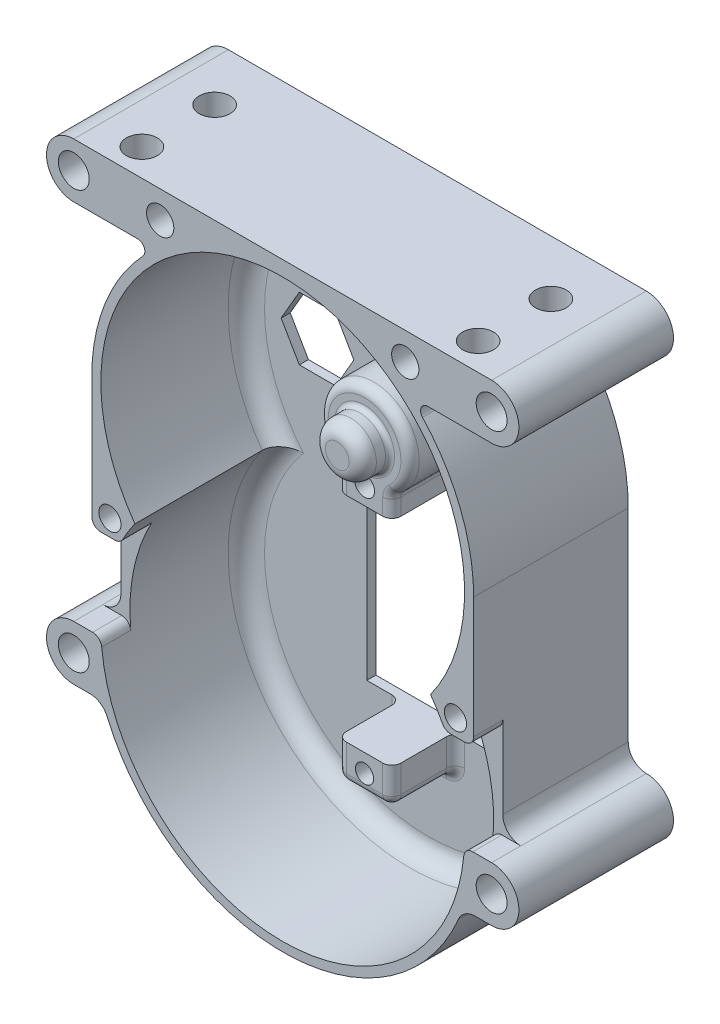
from build123d import *

# Parameters (mm, degrees)
BODY_DEPTH                      = 17
MAIN_BOX_R                      = 20
BOX_DEPTH                       = 16
RACK_CH_DEPTH                   = 3.2
VERRUNDUNG1_R                   = 1
WINGS_START                     = -17
WINGS_DEPTH                     = 17
SKIZZE6_R                       = 1.6999999999999995
WING_HOLE_DEPTH                 = 51.072431865933915
VERRUNDUNG2_R                   = 2
VERRUNDUNG3_R                   = 2
SERVO_HOLE_DEPTH                = 50.74181774893831
SKIZZE8_W                       = 6
SKIZZE8_H                       = 4
SKIZZE8_W_2                     = 5.999999999999996
SERVO_BORE_DEPTH                = 7
SKIZZE10_R                      = 5.000000000000001
GEAR_HOLDER_DEPTH               = 7
MAIN_GEAR_AXIS_R                = 2.8
AXIS_DEPTH                      = 3
VERRUNDUNG11_R                  = 1.5
VERRUNDUNG12_R                  = 0.5
VERRUNDUNG13_R                  = 1
SCREW_HOLE_R                    = 1.0000000000000009
SCREW_HOLE_R_2                  = 1.1000000000000003
SERVO_HOLDER_HOLE_DEPTH         = 48.950478964955025
VERRUNDUNG14_R                  = 1
VERRUNDUNG17_R                  = 1
VERRUNDUNG18_R                  = 2
VERRUNDUNG19_R                  = 1
VERRUNDUNG20_R                  = 1
SCHNITT_LINEAR_AUSTRAGEN1_DEPTH = 50.74181774893831
KREISMUSTER1_COUNT              = 4
KREISMUSTER1_ANGLE              = 180.0000000000004
SKIZZE13_R                      = 1.2193098216311076
SCHNITT_LINEAR_AUSTRAGEN2_DEPTH = 51.072431865933915
BASE_START                      = -17
BASE_WINGS_R                    = 1.6999999999999995
BASE_DEPTH                      = 17
SKIZZE15_R                      = 1.6999999999999995
BASE_HOLES_DEPTH                = 68.90225786791508
VERRUNDUNG22_R                  = 0.8
SKIZZE16_R                      = 1.5000000000000009
SCHNITT_LINEAR_AUSTRAGEN4_DEPTH = 51.072431865933915


with BuildPart() as part:
    # groundplate → body (new body)
    with BuildSketch(Plane.XY):
        with BuildLine():
            Line((22, 5.692561475698), (22.000000000000004, -17.607438524302047))
            ThreePointArc((22.000000000000004, -17.607438524302047), (0.9999999999999785, -38.607438524302005), (-20, -17.607438524302008))
            Line((-20, -17.607438524302008), (-20.000000000000004, 5.692561475697993))
            ThreePointArc((-20.000000000000004, 5.692561475697993), (0.999999999999994, 26.692561475697996), (22, 5.692561475698))
        make_face()
    extrude(amount=BODY_DEPTH)

    # main-box → box (cut)
    with BuildSketch(Plane.XY.offset(17)):
        with Locations((0.9999999999999974, 5.692561475697993)):
            Circle(MAIN_BOX_R)
        with Locations((1.0000000000000009, -17.607438524302005)):
            Circle(MAIN_BOX_R)
    extrude(amount=-BOX_DEPTH, mode=Mode.SUBTRACT)

    # rack-channel → rack-ch (cut)
    with BuildSketch(Plane.XY.offset(17)):
        Polygon((-20.000000000000007, -8.607438524302008), (21.999999999999996, -8.607438524302008), (22, -18.607438524302008), (-20.000000000000004, -18.607438524302008), align=None)
    extrude(amount=-RACK_CH_DEPTH, mode=Mode.SUBTRACT)

    # Verrundung1
    verrundung1_edges = [part.edges().sort_by_distance(p)[0] for p in [
        (21.999999999999996, -8.607438524302008, 15.4),
        (-20.000000000000007, -8.607438524302008, 15.4),
    ]]
    fillet(verrundung1_edges, radius=VERRUNDUNG1_R)

    # wings 2 → wings (add)
    with BuildSketch(Plane.XY.offset(17).offset(WINGS_START)):
        with BuildLine():
            Line((-19.97617696340303, -18.607438524302008), (-21.97617696340303, -18.607438524302008))
            ThreePointArc((-21.97617696340303, -18.607438524302008), (-24.97617696340303, -21.607438524302008), (-21.97617696340303, -24.607438524302008))
            Line((-21.97617696340303, -24.607438524302008), (-18.798989873223324, -24.607438524302008))
            ThreePointArc((-18.798989873223324, -24.607438524302008), (-19.60712395359135, -21.65051190495212), (-19.97617696340303, -18.607438524302008))
        make_face()
        with BuildLine():
            Line((21.976176963403017, -18.607438524302008), (23.97617696340302, -18.607438524302008))
            ThreePointArc((23.97617696340302, -18.607438524302008), (26.97617696340302, -21.607438524302008), (23.97617696340302, -24.607438524302008))
            Line((23.97617696340302, -24.607438524302008), (20.798989873223324, -24.607438524302))
            ThreePointArc((20.798989873223324, -24.607438524302), (21.60712395359134, -21.650511904952104), (21.976176963403017, -18.607438524302008))
        make_face()
    extrude(amount=WINGS_DEPTH)

    # Skizze6 → wing-hole (cut, through all)
    with BuildSketch(Plane.XY.offset(17)):
        with Locations((-21.97617696340303, -21.607438524302008)):
            Circle(SKIZZE6_R)
        with Locations((23.97617696340302, -21.607438524302008)):
            Circle(SKIZZE6_R)
    extrude(amount=-WING_HOLE_DEPTH, mode=Mode.SUBTRACT)

    # Verrundung2
    verrundung2_edges = [part.edges().sort_by_distance(p)[0] for p in [
        (-18.798989873223324, -24.607438524302008, 8.5),
        (20.798989873223327, -24.607438524302005, 8.5),
    ]]
    fillet(verrundung2_edges, radius=VERRUNDUNG2_R)

    # Verrundung3
    # the kernel refuses this fillet: 2 mm, written as the material it adds along each edge
    with BuildSketch(Plane(origin=(-19.97617696340303, -18.607438524302008, 0), x_dir=(-0.999999999857104, -1.6905387508807606e-05, 0), z_dir=(0, 0, 1))) as verrundung3_piece_1:
        with BuildLine():
            CenterArc((2.0237892264922044, -1.9999774591975295), VERRUNDUNG3_R, 90.27202431598047, 89.72700707666411)
            Line((0.02378922677799618, -1.9999436484225084), (-0.17621077319342388, -1.9999402673450066))
            ThreePointArc((-0.17621077319342388, -1.9999402673450066), (-0.17619386876536394, -0.999997021517264), (-0.19977327491231678, -0.00952043228054363))
            Line((-0.19977327491231678, -0.00952043228054363), (3.38107750176e-06, 0.1999999999714201))
            ThreePointArc((3.38107750176e-06, 0.1999999999714201), (2.0000033807917097, 0.19996618919640247), (2.0133442818213974, 0.19999774591975153))
            Line((2.0133442818213974, 0.19999774591975153), (2.0142938222460147, 0))
        make_face()
    extrude(amount=13.8)
    with BuildSketch(Plane(origin=(21.97617696340302, -18.60743852430201, 0), x_dir=(0.999999999857104, -1.690538750704377e-05, 0), z_dir=(0, 0, 1))) as verrundung3_piece_2:
        with BuildLine():
            CenterArc((2.0237892264922217, 1.9999774591975295), VERRUNDUNG3_R, 180.00096860735533, 89.727007076664)
            Line((0.02378922677801392, 1.999943648422512), (-0.17621077319340614, 1.9999402673450104))
            ThreePointArc((-0.17621077319340614, 1.9999402673450104), (-0.17619386876534796, 0.9999970215172324), (-0.19977327491231678, 0.00952043228054398))
            Line((-0.19977327491231678, 0.00952043228054398), (3.38107750141e-06, -0.1999999999714201))
            ThreePointArc((3.38107750141e-06, -0.1999999999714201), (2.0000033807917093, -0.19996618919640244), (2.0133442818214076, -0.19999774591975153))
            Line((2.0133442818214076, -0.19999774591975153), (2.0142938222460254, 0))
        make_face()
    extrude(amount=13.8)

    # servo-cut → servo-hole (cut, through all)
    with BuildSketch(Plane.XY.offset(1.0000000000000009)):
        Polygon((-5.750000000000006, -0.607438524302003), (7.749999999999994, -0.607438524302003), (7.749999999999993, -24.107438524302005), (-5.750000000000002, -24.107438524302005), align=None)
    extrude(amount=-SERVO_HOLE_DEPTH, mode=Mode.SUBTRACT)

    # Skizze8 → servo-bore (add)
    with BuildSketch(Plane.XY.offset(1.0000000000000009)):
        with Locations((0.9999999999999958, -26.107438524302005)):
            Rectangle(SKIZZE8_W, SKIZZE8_H)
        with Locations((0.9999999999999969, 1.3925614756979972)):
            Rectangle(SKIZZE8_W_2, SKIZZE8_H)
    extrude(amount=SERVO_BORE_DEPTH)

    # Skizze10 → gear-holder (add)
    with BuildSketch(Plane.XY.offset(1.0000000000000009)):
        with Locations((0.9999999999999974, 5.692561475697993)):
            Circle(SKIZZE10_R)
    extrude(amount=GEAR_HOLDER_DEPTH)

    # main-gear-axis → axis (add)
    with BuildSketch(Plane.XY.offset(8)):
        with Locations((0.9999999999999974, 5.692561475697993)):
            Circle(MAIN_GEAR_AXIS_R)
    extrude(amount=AXIS_DEPTH)

    # Verrundung11
    verrundung11_edges = [part.edges().sort_by_distance(p)[0] for p in [
        (-1.8000000000000025, 5.692561475697993, 11),
    ]]
    fillet(verrundung11_edges, radius=VERRUNDUNG11_R)

    # Verrundung12
    verrundung12_edges = [part.edges().sort_by_distance(p)[0] for p in [
        (-1.8000000000000025, 5.692561475697993, 8),
    ]]
    fillet(verrundung12_edges, radius=VERRUNDUNG12_R)

    # Verrundung13
    verrundung13_edges = [part.edges().sort_by_distance(p)[0] for p in [
        (3.9999999999999942, 1.6925614756979899, 4.5),
        (-2.000000000000001, 1.6925614756979908, 4.5),
    ]]
    fillet(verrundung13_edges, radius=VERRUNDUNG13_R)

    # screw-hole → servo-holder-hole (cut, through all)
    with BuildSketch(Plane.XY.offset(8)):
        with Locations((0.9999999999999957, -26.107438524302)):
            Circle(SCREW_HOLE_R)
        with Locations((0.9999999999999954, 1.3064934981982024)):
            Circle(SCREW_HOLE_R_2)
    extrude(amount=-SERVO_HOLDER_HOLE_DEPTH, mode=Mode.SUBTRACT)

    # Verrundung14
    verrundung14_edges = [part.edges().sort_by_distance(p)[0] for p in [
        (3.9999999999999947, 0.30649349819820326, 1.0000000000000009),
        (3.9999999999999947, 0.30649349819820326, 8),
        (1.0000000000000022, 10.692561475697994, 8),
        (1.0000000000000022, 10.692561475697996, 1.0000000000000009),
        (-2.000000000000001, 0.30649349819820404, 1.0000000000000009),
        (-2.000000000000001, 0.30649349819820415, 8),
        (4.087129070824718, 1.6286738111622732, 1),
        (-2.087129070824725, 1.6286738111622772, 1),
        (-2.087129070824725, 1.6286738111622772, 8),
        (4.087129070824718, 1.6286738111622727, 8),
    ]]
    fillet(verrundung14_edges, radius=VERRUNDUNG14_R)

    # Verrundung17
    verrundung17_edges = [part.edges().sort_by_distance(p)[0] for p in [
        (3.9999999999999956, -26.107438524302005, 1.0000000000000009),
        (3.9999999999999956, -28.107438524302005, 4.500000000000001),
        (-2.0000000000000044, -26.107438524302005, 1.0000000000000009),
        (0.9999999999999956, -28.107438524302005, 1.0000000000000009),
        (-2.0000000000000044, -28.107438524302005, 4.500000000000001),
        (3.9999999999999956, -26.107438524302005, 8),
        (-2.0000000000000044, -26.107438524302005, 8),
        (0.9999999999999956, -28.107438524302005, 8),
    ]]
    fillet(verrundung17_edges, radius=VERRUNDUNG17_R)

    # Verrundung18
    verrundung18_edges = [part.edges().sort_by_distance(p)[0] for p in [
        (0.9999999999999956, -37.60743852430201, 1),
        (1.0000000000000062, 25.692561475697993, 1),
    ]]
    fillet(verrundung18_edges, radius=VERRUNDUNG18_R)

    # Verrundung19
    verrundung19_edges = [part.edges().sort_by_distance(p)[0] for p in [
        (18.860571099491754, -8.607438524302008, 15.4),
        (-16.860571099491754, -8.607438524302008, 15.4),
    ]]
    fillet(verrundung19_edges, radius=VERRUNDUNG19_R)

    # Verrundung20
    verrundung20_edges = [part.edges().sort_by_distance(p)[0] for p in [
        (20.974984355438178, -18.607438524302008, 15.4),
        (-18.974984355438178, -18.607438524302008, 15.4),
    ]]
    fillet(verrundung20_edges, radius=VERRUNDUNG20_R)

    # Skizze12 → Schnitt-Linear austragen1 (cut, through all)
    with BuildSketch(Plane.XY.offset(1.0000000000000009)):
        Polygon((-7.172693196347616, 5.692561475697853), (-9.172693196347614, 9.156663090835606), (-13.172693196347614, 9.156663090835606), (-15.172693196347614, 5.6925614756978495), (-13.172693196347614, 2.2284598605600965), (-9.172693196347614, 2.228459860560096), align=None)
    schnitt_linear_austragen1 = extrude(amount=-SCHNITT_LINEAR_AUSTRAGEN1_DEPTH, mode=Mode.SUBTRACT)

    # Kreismuster1: Schnitt-Linear austragen1 ×4 about axis
    kreismuster1_axis = Axis((1.0000000000000067, 5.692561475697992, 0), (0, 0, -1))
    for i in range(1, KREISMUSTER1_COUNT):
        add(schnitt_linear_austragen1.rotate(kreismuster1_axis, i * KREISMUSTER1_ANGLE / (KREISMUSTER1_COUNT - 1)), mode=Mode.SUBTRACT)

    # Skizze13 → Schnitt-Linear austragen2 (cut, through all)
    with BuildSketch(Plane.XY.offset(17)):
        with Locations((-18.000000000000004, -6.8074385243020075)):
            Circle(SKIZZE13_R)
        with Locations((19.999999999999996, -6.8074385243020075)):
            Circle(SKIZZE13_R)
    extrude(amount=-SCHNITT_LINEAR_AUSTRAGEN2_DEPTH, mode=Mode.SUBTRACT)

    # base-wings → base (add)
    with BuildSketch(Plane.XY.offset(17).offset(BASE_START)):
        with BuildLine():
            Line((15.002767583588609, 21.342561475697998), (23.97617696340302, 21.342561475697998))
            ThreePointArc((23.97617696340302, 21.342561475698), (26.976176963403017, 24.342561475697998), (23.97617696340302, 27.342561475697995))
            Line((23.976176963403017, 27.342561475697995), (-21.976176963403038, 27.342561475697995))
            ThreePointArc((-21.976176963403038, 27.342561475697998), (-24.976176963403034, 24.342561475697998), (-21.976176963403038, 21.342561475697998))
            Line((-21.976176963403038, 21.342561475697998), (-13.002767583588613, 21.342561475697998))
            ThreePointArc((-13.002767583588613, 21.342561475697998), (0.9999999999999996, 26.692561475697993), (15.00276758358861, 21.342561475697998))
        make_face()
        with Locations((-21.976176963403038, 24.342561475697998)):
            Circle(BASE_WINGS_R, mode=Mode.SUBTRACT)
        with Locations((23.97617696340302, 24.342561475697998)):
            Circle(BASE_WINGS_R, mode=Mode.SUBTRACT)
    extrude(amount=BASE_DEPTH)

    # Skizze15 → base-holes (cut, through all)
    with BuildSketch(Plane.XZ.offset(-21.342561475697998)):
        with Locations(Location((-17.489472273495824, 6, 0), (0, 0, 270))):
            Circle(SKIZZE15_R)
        with Locations(Location((-17.489472273495824, 14.000000000000002, 0), (0, 0, 270))):
            Circle(SKIZZE15_R)
        with Locations(Location((19.489472273495814, 14.000000000000005, 0), (0, 0, 270))):
            Circle(SKIZZE15_R)
        with Locations(Location((19.489472273495814, 5.999999999999999, 0), (0, 0, 270))):
            Circle(SKIZZE15_R)
    extrude(amount=-BASE_HOLES_DEPTH, mode=Mode.SUBTRACT)

    # Verrundung22
    verrundung22_edges = [part.edges().sort_by_distance(p)[0] for p in [
        (15.00276758358861, 21.342561475697998, 8.5),
        (-13.00276758358861, 21.342561475697998, 8.5),
    ]]
    fillet(verrundung22_edges, radius=VERRUNDUNG22_R)

    # Skizze16 → Schnitt-Linear austragen4 (cut, through all)
    with BuildSketch(Plane.XY.offset(17)):
        with Locations((14.476176963403017, 24.34256147569799)):
            Circle(SKIZZE16_R)
        with Locations((-12.476176963403036, 24.34256147569799)):
            Circle(SKIZZE16_R)
    extrude(amount=-SCHNITT_LINEAR_AUSTRAGEN4_DEPTH, mode=Mode.SUBTRACT)


solid = part.part
